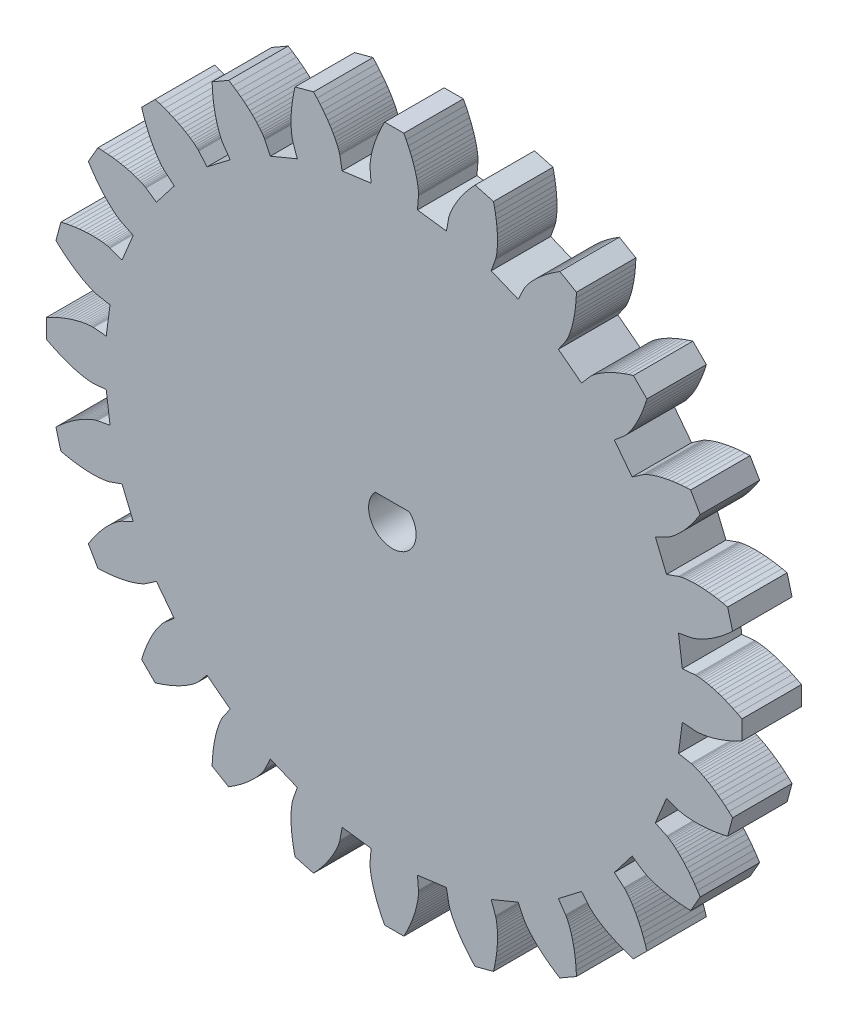
from build123d import *

# Parameters (mm, degrees)
BOSS_EXTRUDE1_DEPTH = 5
CUT_EXTRUDE1_DEPTH  = 5


with BuildPart() as part:
    # Model → Boss-Extrude1 (new body)
    with BuildSketch(Plane.XY):
        Polygon((24.22159213, 1.950506269), (25.289834875, 2.036529275), (25.301377889, 2.037225304), (25.336050103, 2.038383371), (25.393868866, 2.038606926), (25.474788279, 2.036499429), (25.578699232, 2.030666895), (25.705429533, 2.01972044), (25.854744138, 2.002278812), (26.026345471, 1.976970926), (26.219873848, 1.942438371), (26.434907984, 1.897337911), (26.670965604, 1.840343963), (26.927504142, 1.770151047), (27.203921535, 1.68547622), (27.499557107, 1.585061466), (27.813692544, 1.467676065), (28.145552955, 1.332118917), (28.494308031, 1.177220831), (28.859073274, 1.001846768), (29.238911325, 0.804898041), (29.238911325, -0.804898041), (28.859073274, -1.001846768), (28.494308031, -1.177220831), (28.145552955, -1.332118917), (27.813692544, -1.467676065), (27.499557107, -1.585061466), (27.203921535, -1.68547622), (26.927504142, -1.770151047), (26.670965604, -1.840343963), (26.434907984, -1.897337911), (26.219873848, -1.942438371), (26.026345471, -1.976970926), (25.854744138, -2.002278812), (25.705429533, -2.01972044), (25.578699232, -2.030666895), (25.474788279, -2.036499429), (25.393868866, -2.038606926), (25.336050103, -2.038383371), (25.301377889, -2.037225304), (25.289834875, -2.036529275), (24.22159213, -1.950506269), (23.901089562, -4.384964967), (24.955197211, -4.57835469), (24.966527052, -4.58066993), (25.000317568, -4.588525152), (25.056224065, -4.603273812), (25.133840756, -4.626252983), (25.232701458, -4.658780911), (25.352280378, -4.702154591), (25.491992985, -4.757647373), (25.651196982, -4.826506607), (25.829193356, -4.909951324), (26.025227523, -5.009169952), (26.238490556, -5.125318087), (26.468120492, -5.259516296), (26.713203733, -5.412847984), (26.972776516, -5.586357305), (27.24582647, -5.781047129), (27.531294241, -5.997877074), (27.828075201, -6.237761592), (28.135021222, -6.50156812), (28.450942523, -6.790115303), (28.034296639, -8.345058914), (27.616427174, -8.436987455), (27.218700858, -8.511977599), (26.841738749, -8.571333205), (26.486101435, -8.61637956), (26.152288326, -8.648460917), (25.840737041, -8.668938005), (25.551822884, -8.679185522), (25.285858421, -8.680589612), (25.043093151, -8.674545331), (24.823713267, -8.662454101), (24.627841527, -8.645721158), (24.455537205, -8.625753005), (24.306796146, -8.60395486), (24.181550925, -8.581728109), (24.079671081, -8.56046777), (24.000963469, -8.541559971), (23.945172693, -8.526379436), (23.911981636, -8.516287), (23.901012087, -8.512627136), (22.891433222, -8.153053725), (21.951767239, -10.421608086), (22.919904097, -10.88123135), (22.930248655, -10.886400078), (22.960854706, -10.902733269), (23.011039001, -10.931449046), (23.08006352, -10.973733899), (23.167136779, -11.030740498), (23.271415211, -11.103585557), (23.392004638, -11.193347752), (23.527961809, -11.301065691), (23.678296022, -11.427735949), (23.841970816, -11.574311161), (24.017905737, -11.741698178), (24.204978171, -11.930756295), (24.402025242, -12.142295543), (24.60784578, -12.377075057), (24.821202348, -12.635801515), (25.040823321, -12.919127655), (25.265405034, -13.22765087), (25.493613969, -13.561911885), (25.724089007, -13.922393511), (24.919190966, -15.316517813), (24.4917672, -15.297161389), (24.088184203, -15.266657161), (23.708704405, -15.226425301), (23.353526283, -15.177891028), (23.022784314, -15.12248205), (22.716549022, -15.061625991), (22.434827123, -14.996747846), (22.177561775, -14.929267425), (21.944632905, -14.860596823), (21.735857651, -14.792137899), (21.550990883, -14.72527978), (21.389725825, -14.661396386), (21.251694771, -14.601843976), (21.136469883, -14.547958734), (21.043564091, -14.50105438), (20.972432075, -14.462419819), (20.922471335, -14.433316834), (20.893023351, -14.414977811), (20.883374822, -14.408603525), (20.00126097, -13.799984044), (18.506468255, -15.748035837), (19.322657396, -16.442570075), (19.331311706, -16.450240051), (19.356647541, -16.473938132), (19.397689657, -16.514664094), (19.453418098, -16.573372985), (19.522770013, -16.650973349), (19.604641555, -16.748325517), (19.697889832, -16.86623998), (19.80133492, -17.005475824), (19.913761944, -17.166739256), (20.033923199, -17.350682192), (20.160540335, -17.557900943), (20.292306588, -17.78893497), (20.427889057, -18.044265727), (20.565931021, -18.324315599), (20.705054305, -18.629446909), (20.843861674, -18.959961036), (20.980939266, -19.316097601), (21.114859054, -19.698033767), (21.244181335, -20.105883609), (20.105883609, -21.244181335), (19.698033767, -21.114859054), (19.316097601, -20.980939266), (18.959961036, -20.843861674), (18.629446909, -20.705054305), (18.324315599, -20.565931021), (18.044265727, -20.427889057), (17.78893497, -20.292306588), (17.557900943, -20.160540335), (17.350682192, -20.033923199), (17.166739256, -19.913761944), (17.005475824, -19.80133492), (16.86623998, -19.697889832), (16.748325517, -19.604641555), (16.650973349, -19.522770013), (16.573372985, -19.453418098), (16.514664094, -19.397689657), (16.473938132, -19.356647541), (16.450240051, -19.331311706), (16.442570075, -19.322657396), (15.748035837, -18.506468255), (13.799984044, -20.00126097), (14.408603525, -20.883374822), (14.414977811, -20.893023351), (14.433316834, -20.922471335), (14.462419819, -20.972432075), (14.50105438, -21.043564091), (14.547958734, -21.136469883), (14.601843976, -21.251694771), (14.661396386, -21.389725825), (14.72527978, -21.550990883), (14.792137899, -21.735857651), (14.860596823, -21.944632905), (14.929267425, -22.177561775), (14.996747846, -22.434827123), (15.061625991, -22.716549022), (15.12248205, -23.022784314), (15.177891028, -23.353526283), (15.226425301, -23.708704405), (15.266657161, -24.088184203), (15.297161389, -24.4917672), (15.316517813, -24.919190966), (13.922393511, -25.724089007), (13.561911885, -25.493613969), (13.22765087, -25.265405034), (12.919127655, -25.040823321), (12.635801515, -24.821202348), (12.377075057, -24.60784578), (12.142295543, -24.402025242), (11.930756295, -24.204978171), (11.741698178, -24.017905737), (11.574311161, -23.841970816), (11.427735949, -23.678296022), (11.301065691, -23.527961809), (11.193347752, -23.392004638), (11.103585557, -23.271415211), (11.030740498, -23.167136779), (10.973733899, -23.08006352), (10.931449046, -23.011039001), (10.902733269, -22.960854706), (10.886400078, -22.930248655), (10.88123135, -22.919904097), (10.421608086, -21.951767239), (8.153053725, -22.891433222), (8.512627136, -23.901012087), (8.516287, -23.911981636), (8.526379436, -23.945172693), (8.541559971, -24.000963469), (8.56046777, -24.079671081), (8.581728109, -24.181550925), (8.60395486, -24.306796146), (8.625753005, -24.455537205), (8.645721158, -24.627841527), (8.662454101, -24.823713267), (8.674545331, -25.043093151), (8.680589612, -25.285858421), (8.679185522, -25.551822884), (8.668938005, -25.840737041), (8.648460917, -26.152288326), (8.61637956, -26.486101435), (8.571333205, -26.841738749), (8.511977599, -27.218700858), (8.436987455, -27.616427174), (8.345058914, -28.034296639), (6.790115303, -28.450942523), (6.50156812, -28.135021222), (6.237761592, -27.828075201), (5.997877074, -27.531294241), (5.781047129, -27.24582647), (5.586357305, -26.972776516), (5.412847984, -26.713203733), (5.259516296, -26.468120492), (5.125318087, -26.238490556), (5.009169952, -26.025227523), (4.909951324, -25.829193356), (4.826506607, -25.651196982), (4.757647373, -25.491992985), (4.702154591, -25.352280378), (4.658780911, -25.232701458), (4.626252983, -25.133840756), (4.603273812, -25.056224065), (4.588525152, -25.000317568), (4.58066993, -24.966527052), (4.57835469, -24.955197211), (4.384964967, -23.901089562), (1.950506269, -24.22159213), (2.036529275, -25.289834875), (2.037225304, -25.301377889), (2.038383371, -25.336050103), (2.038606926, -25.393868866), (2.036499429, -25.474788279), (2.030666895, -25.578699232), (2.01972044, -25.705429533), (2.002278812, -25.854744138), (1.976970926, -26.026345471), (1.942438371, -26.219873848), (1.897337911, -26.434907984), (1.840343963, -26.670965604), (1.770151047, -26.927504142), (1.68547622, -27.203921535), (1.585061466, -27.499557107), (1.467676065, -27.813692544), (1.332118917, -28.145552955), (1.177220831, -28.494308031), (1.001846768, -28.859073274), (0.804898041, -29.238911325), (-0.804898041, -29.238911325), (-1.001846768, -28.859073274), (-1.177220831, -28.494308031), (-1.332118917, -28.145552955), (-1.467676065, -27.813692544), (-1.585061466, -27.499557107), (-1.68547622, -27.203921535), (-1.770151047, -26.927504142), (-1.840343963, -26.670965604), (-1.897337911, -26.434907984), (-1.942438371, -26.219873848), (-1.976970926, -26.026345471), (-2.002278812, -25.854744138), (-2.01972044, -25.705429533), (-2.030666895, -25.578699232), (-2.036499429, -25.474788279), (-2.038606926, -25.393868866), (-2.038383371, -25.336050103), (-2.037225304, -25.301377889), (-2.036529275, -25.289834875), (-1.950506269, -24.22159213), (-4.384964967, -23.901089562), (-4.57835469, -24.955197211), (-4.58066993, -24.966527052), (-4.588525152, -25.000317568), (-4.603273812, -25.056224065), (-4.626252983, -25.133840756), (-4.658780911, -25.232701458), (-4.702154591, -25.352280378), (-4.757647373, -25.491992985), (-4.826506607, -25.651196982), (-4.909951324, -25.829193356), (-5.009169952, -26.025227523), (-5.125318087, -26.238490556), (-5.259516296, -26.468120492), (-5.412847984, -26.713203733), (-5.586357305, -26.972776516), (-5.781047129, -27.24582647), (-5.997877074, -27.531294241), (-6.237761592, -27.828075201), (-6.50156812, -28.135021222), (-6.790115303, -28.450942523), (-8.345058914, -28.034296639), (-8.436987455, -27.616427174), (-8.511977599, -27.218700858), (-8.571333205, -26.841738749), (-8.61637956, -26.486101435), (-8.648460917, -26.152288326), (-8.668938005, -25.840737041), (-8.679185522, -25.551822884), (-8.680589612, -25.285858421), (-8.674545331, -25.043093151), (-8.662454101, -24.823713267), (-8.645721158, -24.627841527), (-8.625753005, -24.455537205), (-8.60395486, -24.306796146), (-8.581728109, -24.181550925), (-8.56046777, -24.079671081), (-8.541559971, -24.000963469), (-8.526379436, -23.945172693), (-8.516287, -23.911981636), (-8.512627136, -23.901012087), (-8.153053725, -22.891433222), (-10.421608086, -21.951767239), (-10.88123135, -22.919904097), (-10.886400078, -22.930248655), (-10.902733269, -22.960854706), (-10.931449046, -23.011039001), (-10.973733899, -23.08006352), (-11.030740498, -23.167136779), (-11.103585557, -23.271415211), (-11.193347752, -23.392004638), (-11.301065691, -23.527961809), (-11.427735949, -23.678296022), (-11.574311161, -23.841970816), (-11.741698178, -24.017905737), (-11.930756295, -24.204978171), (-12.142295543, -24.402025242), (-12.377075057, -24.60784578), (-12.635801515, -24.821202348), (-12.919127655, -25.040823321), (-13.22765087, -25.265405034), (-13.561911885, -25.493613969), (-13.922393511, -25.724089007), (-15.316517813, -24.919190966), (-15.297161389, -24.4917672), (-15.266657161, -24.088184203), (-15.226425301, -23.708704405), (-15.177891028, -23.353526283), (-15.12248205, -23.022784314), (-15.061625991, -22.716549022), (-14.996747846, -22.434827123), (-14.929267425, -22.177561775), (-14.860596823, -21.944632905), (-14.792137899, -21.735857651), (-14.72527978, -21.550990883), (-14.661396386, -21.389725825), (-14.601843976, -21.251694771), (-14.547958734, -21.136469883), (-14.50105438, -21.043564091), (-14.462419819, -20.972432075), (-14.433316834, -20.922471335), (-14.414977811, -20.893023351), (-14.408603525, -20.883374822), (-13.799984044, -20.00126097), (-15.748035837, -18.506468255), (-16.442570075, -19.322657396), (-16.450240051, -19.331311706), (-16.473938132, -19.356647541), (-16.514664094, -19.397689657), (-16.573372985, -19.453418098), (-16.650973349, -19.522770013), (-16.748325517, -19.604641555), (-16.86623998, -19.697889832), (-17.005475824, -19.80133492), (-17.166739256, -19.913761944), (-17.350682192, -20.033923199), (-17.557900943, -20.160540335), (-17.78893497, -20.292306588), (-18.044265727, -20.427889057), (-18.324315599, -20.565931021), (-18.629446909, -20.705054305), (-18.959961036, -20.843861674), (-19.316097601, -20.980939266), (-19.698033767, -21.114859054), (-20.105883609, -21.244181335), (-21.244181335, -20.105883609), (-21.114859054, -19.698033767), (-20.980939266, -19.316097601), (-20.843861674, -18.959961036), (-20.705054305, -18.629446909), (-20.565931021, -18.324315599), (-20.427889057, -18.044265727), (-20.292306588, -17.78893497), (-20.160540335, -17.557900943), (-20.033923199, -17.350682192), (-19.913761944, -17.166739256), (-19.80133492, -17.005475824), (-19.697889832, -16.86623998), (-19.604641555, -16.748325517), (-19.522770013, -16.650973349), (-19.453418098, -16.573372985), (-19.397689657, -16.514664094), (-19.356647541, -16.473938132), (-19.331311706, -16.450240051), (-19.322657396, -16.442570075), (-18.506468255, -15.748035837), (-20.00126097, -13.799984044), (-20.883374822, -14.408603525), (-20.893023351, -14.414977811), (-20.922471335, -14.433316834), (-20.972432075, -14.462419819), (-21.043564091, -14.50105438), (-21.136469883, -14.547958734), (-21.251694771, -14.601843976), (-21.389725825, -14.661396386), (-21.550990883, -14.72527978), (-21.735857651, -14.792137899), (-21.944632905, -14.860596823), (-22.177561775, -14.929267425), (-22.434827123, -14.996747846), (-22.716549022, -15.061625991), (-23.022784314, -15.12248205), (-23.353526283, -15.177891028), (-23.708704405, -15.226425301), (-24.088184203, -15.266657161), (-24.4917672, -15.297161389), (-24.919190966, -15.316517813), (-25.724089007, -13.922393511), (-25.493613969, -13.561911885), (-25.265405034, -13.22765087), (-25.040823321, -12.919127655), (-24.821202348, -12.635801515), (-24.60784578, -12.377075057), (-24.402025242, -12.142295543), (-24.204978171, -11.930756295), (-24.017905737, -11.741698178), (-23.841970816, -11.574311161), (-23.678296022, -11.427735949), (-23.527961809, -11.301065691), (-23.392004638, -11.193347752), (-23.271415211, -11.103585557), (-23.167136779, -11.030740498), (-23.08006352, -10.973733899), (-23.011039001, -10.931449046), (-22.960854706, -10.902733269), (-22.930248655, -10.886400078), (-22.919904097, -10.88123135), (-21.951767239, -10.421608086), (-22.891433222, -8.153053725), (-23.901012087, -8.512627136), (-23.911981636, -8.516287), (-23.945172693, -8.526379436), (-24.000963469, -8.541559971), (-24.079671081, -8.56046777), (-24.181550925, -8.581728109), (-24.306796146, -8.60395486), (-24.455537205, -8.625753005), (-24.627841527, -8.645721158), (-24.823713267, -8.662454101), (-25.043093151, -8.674545331), (-25.285858421, -8.680589612), (-25.551822884, -8.679185522), (-25.840737041, -8.668938005), (-26.152288326, -8.648460917), (-26.486101435, -8.61637956), (-26.841738749, -8.571333205), (-27.218700858, -8.511977599), (-27.616427174, -8.436987455), (-28.034296639, -8.345058914), (-28.450942523, -6.790115303), (-28.135021222, -6.50156812), (-27.828075201, -6.237761592), (-27.531294241, -5.997877074), (-27.24582647, -5.781047129), (-26.972776516, -5.586357305), (-26.713203733, -5.412847984), (-26.468120492, -5.259516296), (-26.238490556, -5.125318087), (-26.025227523, -5.009169952), (-25.829193356, -4.909951324), (-25.651196982, -4.826506607), (-25.491992985, -4.757647373), (-25.352280378, -4.702154591), (-25.232701458, -4.658780911), (-25.133840756, -4.626252983), (-25.056224065, -4.603273812), (-25.000317568, -4.588525152), (-24.966527052, -4.58066993), (-24.955197211, -4.57835469), (-23.901089562, -4.384964967), (-24.22159213, -1.950506269), (-25.289834875, -2.036529275), (-25.301377889, -2.037225304), (-25.336050103, -2.038383371), (-25.393868866, -2.038606926), (-25.474788279, -2.036499429), (-25.578699232, -2.030666895), (-25.705429533, -2.01972044), (-25.854744138, -2.002278812), (-26.026345471, -1.976970926), (-26.219873848, -1.942438371), (-26.434907984, -1.897337911), (-26.670965604, -1.840343963), (-26.927504142, -1.770151047), (-27.203921535, -1.68547622), (-27.499557107, -1.585061466), (-27.813692544, -1.467676065), (-28.145552955, -1.332118917), (-28.494308031, -1.177220831), (-28.859073274, -1.001846768), (-29.238911325, -0.804898041), (-29.238911325, 0.804898041), (-28.859073274, 1.001846768), (-28.494308031, 1.177220831), (-28.145552955, 1.332118917), (-27.813692544, 1.467676065), (-27.499557107, 1.585061466), (-27.203921535, 1.68547622), (-26.927504142, 1.770151047), (-26.670965604, 1.840343963), (-26.434907984, 1.897337911), (-26.219873848, 1.942438371), (-26.026345471, 1.976970926), (-25.854744138, 2.002278812), (-25.705429533, 2.01972044), (-25.578699232, 2.030666895), (-25.474788279, 2.036499429), (-25.393868866, 2.038606926), (-25.336050103, 2.038383371), (-25.301377889, 2.037225304), (-25.289834875, 2.036529275), (-24.22159213, 1.950506269), (-23.901089562, 4.384964967), (-24.955197211, 4.57835469), (-24.966527052, 4.58066993), (-25.000317568, 4.588525152), (-25.056224065, 4.603273812), (-25.133840756, 4.626252983), (-25.232701458, 4.658780911), (-25.352280378, 4.702154591), (-25.491992985, 4.757647373), (-25.651196982, 4.826506607), (-25.829193356, 4.909951324), (-26.025227523, 5.009169952), (-26.238490556, 5.125318087), (-26.468120492, 5.259516296), (-26.713203733, 5.412847984), (-26.972776516, 5.586357305), (-27.24582647, 5.781047129), (-27.531294241, 5.997877074), (-27.828075201, 6.237761592), (-28.135021222, 6.50156812), (-28.450942523, 6.790115303), (-28.034296639, 8.345058914), (-27.616427174, 8.436987455), (-27.218700858, 8.511977599), (-26.841738749, 8.571333205), (-26.486101435, 8.61637956), (-26.152288326, 8.648460917), (-25.840737041, 8.668938005), (-25.551822884, 8.679185522), (-25.285858421, 8.680589612), (-25.043093151, 8.674545331), (-24.823713267, 8.662454101), (-24.627841527, 8.645721158), (-24.455537205, 8.625753005), (-24.306796146, 8.60395486), (-24.181550925, 8.581728109), (-24.079671081, 8.56046777), (-24.000963469, 8.541559971), (-23.945172693, 8.526379436), (-23.911981636, 8.516287), (-23.901012087, 8.512627136), (-22.891433222, 8.153053725), (-21.951767239, 10.421608086), (-22.919904097, 10.88123135), (-22.930248655, 10.886400078), (-22.960854706, 10.902733269), (-23.011039001, 10.931449046), (-23.08006352, 10.973733899), (-23.167136779, 11.030740498), (-23.271415211, 11.103585557), (-23.392004638, 11.193347752), (-23.527961809, 11.301065691), (-23.678296022, 11.427735949), (-23.841970816, 11.574311161), (-24.017905737, 11.741698178), (-24.204978171, 11.930756295), (-24.402025242, 12.142295543), (-24.60784578, 12.377075057), (-24.821202348, 12.635801515), (-25.040823321, 12.919127655), (-25.265405034, 13.22765087), (-25.493613969, 13.561911885), (-25.724089007, 13.922393511), (-24.919190966, 15.316517813), (-24.4917672, 15.297161389), (-24.088184203, 15.266657161), (-23.708704405, 15.226425301), (-23.353526283, 15.177891028), (-23.022784314, 15.12248205), (-22.716549022, 15.061625991), (-22.434827123, 14.996747846), (-22.177561775, 14.929267425), (-21.944632905, 14.860596823), (-21.735857651, 14.792137899), (-21.550990883, 14.72527978), (-21.389725825, 14.661396386), (-21.251694771, 14.601843976), (-21.136469883, 14.547958734), (-21.043564091, 14.50105438), (-20.972432075, 14.462419819), (-20.922471335, 14.433316834), (-20.893023351, 14.414977811), (-20.883374822, 14.408603525), (-20.00126097, 13.799984044), (-18.506468255, 15.748035837), (-19.322657396, 16.442570075), (-19.331311706, 16.450240051), (-19.356647541, 16.473938132), (-19.397689657, 16.514664094), (-19.453418098, 16.573372985), (-19.522770013, 16.650973349), (-19.604641555, 16.748325517), (-19.697889832, 16.86623998), (-19.80133492, 17.005475824), (-19.913761944, 17.166739256), (-20.033923199, 17.350682192), (-20.160540335, 17.557900943), (-20.292306588, 17.78893497), (-20.427889057, 18.044265727), (-20.565931021, 18.324315599), (-20.705054305, 18.629446909), (-20.843861674, 18.959961036), (-20.980939266, 19.316097601), (-21.114859054, 19.698033767), (-21.244181335, 20.105883609), (-20.105883609, 21.244181335), (-19.698033767, 21.114859054), (-19.316097601, 20.980939266), (-18.959961036, 20.843861674), (-18.629446909, 20.705054305), (-18.324315599, 20.565931021), (-18.044265727, 20.427889057), (-17.78893497, 20.292306588), (-17.557900943, 20.160540335), (-17.350682192, 20.033923199), (-17.166739256, 19.913761944), (-17.005475824, 19.80133492), (-16.86623998, 19.697889832), (-16.748325517, 19.604641555), (-16.650973349, 19.522770013), (-16.573372985, 19.453418098), (-16.514664094, 19.397689657), (-16.473938132, 19.356647541), (-16.450240051, 19.331311706), (-16.442570075, 19.322657396), (-15.748035837, 18.506468255), (-13.799984044, 20.00126097), (-14.408603525, 20.883374822), (-14.414977811, 20.893023351), (-14.433316834, 20.922471335), (-14.462419819, 20.972432075), (-14.50105438, 21.043564091), (-14.547958734, 21.136469883), (-14.601843976, 21.251694771), (-14.661396386, 21.389725825), (-14.72527978, 21.550990883), (-14.792137899, 21.735857651), (-14.860596823, 21.944632905), (-14.929267425, 22.177561775), (-14.996747846, 22.434827123), (-15.061625991, 22.716549022), (-15.12248205, 23.022784314), (-15.177891028, 23.353526283), (-15.226425301, 23.708704405), (-15.266657161, 24.088184203), (-15.297161389, 24.4917672), (-15.316517813, 24.919190966), (-13.922393511, 25.724089007), (-13.561911885, 25.493613969), (-13.22765087, 25.265405034), (-12.919127655, 25.040823321), (-12.635801515, 24.821202348), (-12.377075057, 24.60784578), (-12.142295543, 24.402025242), (-11.930756295, 24.204978171), (-11.741698178, 24.017905737), (-11.574311161, 23.841970816), (-11.427735949, 23.678296022), (-11.301065691, 23.527961809), (-11.193347752, 23.392004638), (-11.103585557, 23.271415211), (-11.030740498, 23.167136779), (-10.973733899, 23.08006352), (-10.931449046, 23.011039001), (-10.902733269, 22.960854706), (-10.886400078, 22.930248655), (-10.88123135, 22.919904097), (-10.421608086, 21.951767239), (-8.153053725, 22.891433222), (-8.512627136, 23.901012087), (-8.516287, 23.911981636), (-8.526379436, 23.945172693), (-8.541559971, 24.000963469), (-8.56046777, 24.079671081), (-8.581728109, 24.181550925), (-8.60395486, 24.306796146), (-8.625753005, 24.455537205), (-8.645721158, 24.627841527), (-8.662454101, 24.823713267), (-8.674545331, 25.043093151), (-8.680589612, 25.285858421), (-8.679185522, 25.551822884), (-8.668938005, 25.840737041), (-8.648460917, 26.152288326), (-8.61637956, 26.486101435), (-8.571333205, 26.841738749), (-8.511977599, 27.218700858), (-8.436987455, 27.616427174), (-8.345058914, 28.034296639), (-6.790115303, 28.450942523), (-6.50156812, 28.135021222), (-6.237761592, 27.828075201), (-5.997877074, 27.531294241), (-5.781047129, 27.24582647), (-5.586357305, 26.972776516), (-5.412847984, 26.713203733), (-5.259516296, 26.468120492), (-5.125318087, 26.238490556), (-5.009169952, 26.025227523), (-4.909951324, 25.829193356), (-4.826506607, 25.651196982), (-4.757647373, 25.491992985), (-4.702154591, 25.352280378), (-4.658780911, 25.232701458), (-4.626252983, 25.133840756), (-4.603273812, 25.056224065), (-4.588525152, 25.000317568), (-4.58066993, 24.966527052), (-4.57835469, 24.955197211), (-4.384964967, 23.901089562), (-1.950506269, 24.22159213), (-2.036529275, 25.289834875), (-2.037225304, 25.301377889), (-2.038383371, 25.336050103), (-2.038606926, 25.393868866), (-2.036499429, 25.474788279), (-2.030666895, 25.578699232), (-2.01972044, 25.705429533), (-2.002278812, 25.854744138), (-1.976970926, 26.026345471), (-1.942438371, 26.219873848), (-1.897337911, 26.434907984), (-1.840343963, 26.670965604), (-1.770151047, 26.927504142), (-1.68547622, 27.203921535), (-1.585061466, 27.499557107), (-1.467676065, 27.813692544), (-1.332118917, 28.145552955), (-1.177220831, 28.494308031), (-1.001846768, 28.859073274), (-0.804898041, 29.238911325), (0.804898041, 29.238911325), (1.001846768, 28.859073274), (1.177220831, 28.494308031), (1.332118917, 28.145552955), (1.467676065, 27.813692544), (1.585061466, 27.499557107), (1.68547622, 27.203921535), (1.770151047, 26.927504142), (1.840343963, 26.670965604), (1.897337911, 26.434907984), (1.942438371, 26.219873848), (1.976970926, 26.026345471), (2.002278812, 25.854744138), (2.01972044, 25.705429533), (2.030666895, 25.578699232), (2.036499429, 25.474788279), (2.038606926, 25.393868866), (2.038383371, 25.336050103), (2.037225304, 25.301377889), (2.036529275, 25.289834875), (1.950506269, 24.22159213), (4.384964967, 23.901089562), (4.57835469, 24.955197211), (4.58066993, 24.966527052), (4.588525152, 25.000317568), (4.603273812, 25.056224065), (4.626252983, 25.133840756), (4.658780911, 25.232701458), (4.702154591, 25.352280378), (4.757647373, 25.491992985), (4.826506607, 25.651196982), (4.909951324, 25.829193356), (5.009169952, 26.025227523), (5.125318087, 26.238490556), (5.259516296, 26.468120492), (5.412847984, 26.713203733), (5.586357305, 26.972776516), (5.781047129, 27.24582647), (5.997877074, 27.531294241), (6.237761592, 27.828075201), (6.50156812, 28.135021222), (6.790115303, 28.450942523), (8.345058914, 28.034296639), (8.436987455, 27.616427174), (8.511977599, 27.218700858), (8.571333205, 26.841738749), (8.61637956, 26.486101435), (8.648460917, 26.152288326), (8.668938005, 25.840737041), (8.679185522, 25.551822884), (8.680589612, 25.285858421), (8.674545331, 25.043093151), (8.662454101, 24.823713267), (8.645721158, 24.627841527), (8.625753005, 24.455537205), (8.60395486, 24.306796146), (8.581728109, 24.181550925), (8.56046777, 24.079671081), (8.541559971, 24.000963469), (8.526379436, 23.945172693), (8.516287, 23.911981636), (8.512627136, 23.901012087), (8.153053725, 22.891433222), (10.421608086, 21.951767239), (10.88123135, 22.919904097), (10.886400078, 22.930248655), (10.902733269, 22.960854706), (10.931449046, 23.011039001), (10.973733899, 23.08006352), (11.030740498, 23.167136779), (11.103585557, 23.271415211), (11.193347752, 23.392004638), (11.301065691, 23.527961809), (11.427735949, 23.678296022), (11.574311161, 23.841970816), (11.741698178, 24.017905737), (11.930756295, 24.204978171), (12.142295543, 24.402025242), (12.377075057, 24.60784578), (12.635801515, 24.821202348), (12.919127655, 25.040823321), (13.22765087, 25.265405034), (13.561911885, 25.493613969), (13.922393511, 25.724089007), (15.316517813, 24.919190966), (15.297161389, 24.4917672), (15.266657161, 24.088184203), (15.226425301, 23.708704405), (15.177891028, 23.353526283), (15.12248205, 23.022784314), (15.061625991, 22.716549022), (14.996747846, 22.434827123), (14.929267425, 22.177561775), (14.860596823, 21.944632905), (14.792137899, 21.735857651), (14.72527978, 21.550990883), (14.661396386, 21.389725825), (14.601843976, 21.251694771), (14.547958734, 21.136469883), (14.50105438, 21.043564091), (14.462419819, 20.972432075), (14.433316834, 20.922471335), (14.414977811, 20.893023351), (14.408603525, 20.883374822), (13.799984044, 20.00126097), (15.748035837, 18.506468255), (16.442570075, 19.322657396), (16.450240051, 19.331311706), (16.473938132, 19.356647541), (16.514664094, 19.397689657), (16.573372985, 19.453418098), (16.650973349, 19.522770013), (16.748325517, 19.604641555), (16.86623998, 19.697889832), (17.005475824, 19.80133492), (17.166739256, 19.913761944), (17.350682192, 20.033923199), (17.557900943, 20.160540335), (17.78893497, 20.292306588), (18.044265727, 20.427889057), (18.324315599, 20.565931021), (18.629446909, 20.705054305), (18.959961036, 20.843861674), (19.316097601, 20.980939266), (19.698033767, 21.114859054), (20.105883609, 21.244181335), (21.244181335, 20.105883609), (21.114859054, 19.698033767), (20.980939266, 19.316097601), (20.843861674, 18.959961036), (20.705054305, 18.629446909), (20.565931021, 18.324315599), (20.427889057, 18.044265727), (20.292306588, 17.78893497), (20.160540335, 17.557900943), (20.033923199, 17.350682192), (19.913761944, 17.166739256), (19.80133492, 17.005475824), (19.697889832, 16.86623998), (19.604641555, 16.748325517), (19.522770013, 16.650973349), (19.453418098, 16.573372985), (19.397689657, 16.514664094), (19.356647541, 16.473938132), (19.331311706, 16.450240051), (19.322657396, 16.442570075), (18.506468255, 15.748035837), (20.00126097, 13.799984044), (20.883374822, 14.408603525), (20.893023351, 14.414977811), (20.922471335, 14.433316834), (20.972432075, 14.462419819), (21.043564091, 14.50105438), (21.136469883, 14.547958734), (21.251694771, 14.601843976), (21.389725825, 14.661396386), (21.550990883, 14.72527978), (21.735857651, 14.792137899), (21.944632905, 14.860596823), (22.177561775, 14.929267425), (22.434827123, 14.996747846), (22.716549022, 15.061625991), (23.022784314, 15.12248205), (23.353526283, 15.177891028), (23.708704405, 15.226425301), (24.088184203, 15.266657161), (24.4917672, 15.297161389), (24.919190966, 15.316517813), (25.724089007, 13.922393511), (25.493613969, 13.561911885), (25.265405034, 13.22765087), (25.040823321, 12.919127655), (24.821202348, 12.635801515), (24.60784578, 12.377075057), (24.402025242, 12.142295543), (24.204978171, 11.930756295), (24.017905737, 11.741698178), (23.841970816, 11.574311161), (23.678296022, 11.427735949), (23.527961809, 11.301065691), (23.392004638, 11.193347752), (23.271415211, 11.103585557), (23.167136779, 11.030740498), (23.08006352, 10.973733899), (23.011039001, 10.931449046), (22.960854706, 10.902733269), (22.930248655, 10.886400078), (22.919904097, 10.88123135), (21.951767239, 10.421608086), (22.891433222, 8.153053725), (23.901012087, 8.512627136), (23.911981636, 8.516287), (23.945172693, 8.526379436), (24.000963469, 8.541559971), (24.079671081, 8.56046777), (24.181550925, 8.581728109), (24.306796146, 8.60395486), (24.455537205, 8.625753005), (24.627841527, 8.645721158), (24.823713267, 8.662454101), (25.043093151, 8.674545331), (25.285858421, 8.680589612), (25.551822884, 8.679185522), (25.840737041, 8.668938005), (26.152288326, 8.648460917), (26.486101435, 8.61637956), (26.841738749, 8.571333205), (27.218700858, 8.511977599), (27.616427174, 8.436987455), (28.034296639, 8.345058914), (28.450942523, 6.790115303), (28.135021222, 6.50156812), (27.828075201, 6.237761592), (27.531294241, 5.997877074), (27.24582647, 5.781047129), (26.972776516, 5.586357305), (26.713203733, 5.412847984), (26.468120492, 5.259516296), (26.238490556, 5.125318087), (26.025227523, 5.009169952), (25.829193356, 4.909951324), (25.651196982, 4.826506607), (25.491992985, 4.757647373), (25.352280378, 4.702154591), (25.232701458, 4.658780911), (25.133840756, 4.626252983), (25.056224065, 4.603273812), (25.000317568, 4.588525152), (24.966527052, 4.58066993), (24.955197211, 4.57835469), (23.901089562, 4.384964967), align=None)
    extrude(amount=BOSS_EXTRUDE1_DEPTH)

    # Sketch2 → Cut-Extrude1 (cut)
    with BuildSketch(Plane.XY.offset(5)):
        with BuildLine():
            Line((-1.59967607, 1.897070748), (1.276362873, 1.897070748))
            ThreePointArc((1.276362873, 1.897070748), (-0.161656598, -1.492929252), (-1.59967607, 1.897070748))
        make_face()
    extrude(amount=-CUT_EXTRUDE1_DEPTH, mode=Mode.SUBTRACT)


solid = part.part
